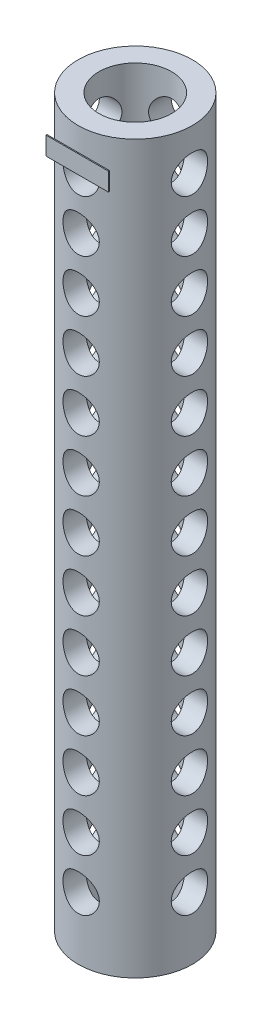
from build123d import *

# Parameters (mm, degrees)
SKETCH1_R           = 5.5
SKETCH1_R_2         = 3.5
BOSS_EXTRUDE1_DEPTH = 70
SKETCH2_R           = 1.75
CUT_EXTRUDE1_DEPTH  = 10
CIRPATTERN1_COUNT   = 4
SKETCH4_W           = 6
SKETCH4_H           = 1.75
BOSS_EXTRUDE2_DEPTH = 0.1


with BuildPart() as part:
    # Sketch1 → Boss-Extrude1 (new body)
    with BuildSketch(Plane(origin=(0, 0, 0), x_dir=(1, 0, 0), z_dir=(0, 1, 0))):
        with Locations(Location((0, 0, 0), (0, 0, 270))):
            Circle(SKETCH1_R)
        with Locations(Location((0, 0, 0), (0, 0, 270))):
            Circle(SKETCH1_R_2, mode=Mode.SUBTRACT)
    extrude(amount=BOSS_EXTRUDE1_DEPTH)

    # Sketch2 → Cut-Extrude1 (cut, symmetric)
    with BuildSketch(Plane.XY):
        with Locations(Location((0, 66, 0), (0, 0, 180))):
            Circle(SKETCH2_R)
        with Locations(Location((0, 61, 0), (0, 0, 180))):
            Circle(SKETCH2_R)
        with Locations(Location((0, 56, 0), (0, 0, 180))):
            Circle(SKETCH2_R)
        with Locations(Location((0, 51, 0), (0, 0, 180))):
            Circle(SKETCH2_R)
        with Locations(Location((0, 46, 0), (0, 0, 180))):
            Circle(SKETCH2_R)
        with Locations(Location((0, 41, 0), (0, 0, 180))):
            Circle(SKETCH2_R)
        with Locations(Location((0, 36, 0), (0, 0, 180))):
            Circle(SKETCH2_R)
        with Locations(Location((0, 31, 0), (0, 0, 180))):
            Circle(SKETCH2_R)
        with Locations(Location((0, 26, 0), (0, 0, 180))):
            Circle(SKETCH2_R)
        with Locations(Location((0, 21, 0), (0, 0, 180))):
            Circle(SKETCH2_R)
        with Locations(Location((0, 16, 0), (0, 0, 180))):
            Circle(SKETCH2_R)
        with Locations(Location((0, 11, 0), (0, 0, 180))):
            Circle(SKETCH2_R)
        with Locations(Location((0, 6, 0), (0, 0, 180))):
            Circle(SKETCH2_R)
    cut_extrude1 = extrude(amount=CUT_EXTRUDE1_DEPTH, both=True, mode=Mode.SUBTRACT)

    # CirPattern1: Cut-Extrude1 ×4 about axis
    cirpattern1_axis = Axis((0, 70, 0), (0, 1, 0))
    for i in range(1, CIRPATTERN1_COUNT):
        add(cut_extrude1.rotate(cirpattern1_axis, i * 360 / CIRPATTERN1_COUNT), mode=Mode.SUBTRACT)


with BuildPart() as body_2:
    # Sketch4 → Boss-Extrude2 (new body)
    with BuildSketch(Plane.XY.offset(5.5)):
        with Locations((0, 66.875)):
            Rectangle(SKETCH4_W, SKETCH4_H)
    extrude(amount=BOSS_EXTRUDE2_DEPTH)


solid = Compound([part.part, body_2.part])
